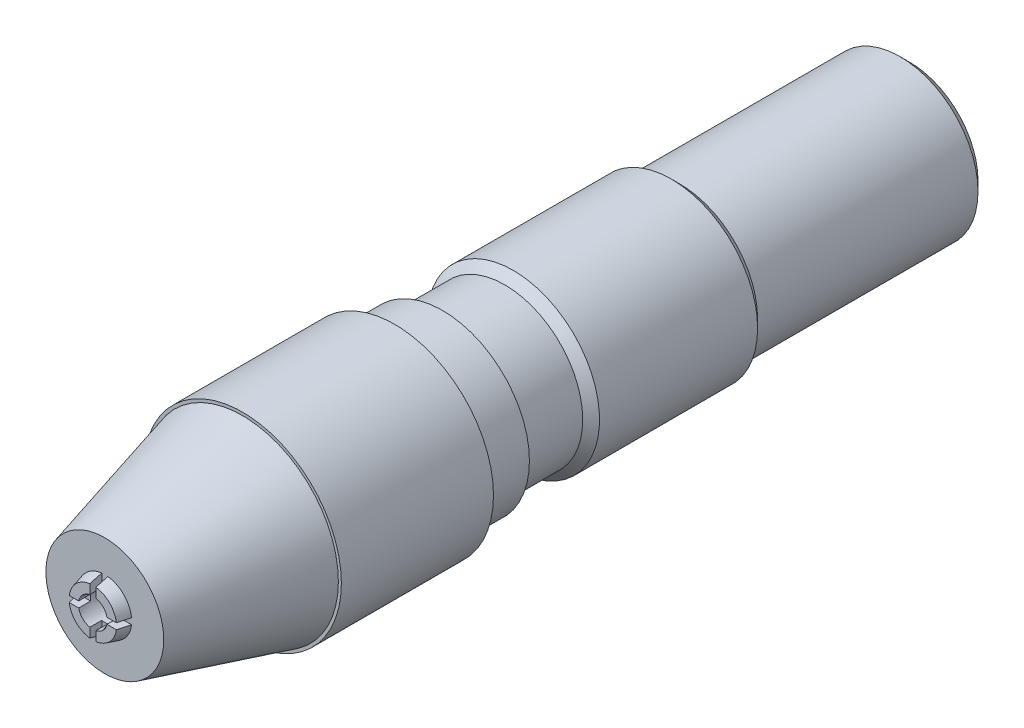
from build123d import *

# Parameters (mm, degrees)
SKETCH1_R               = 3.25
EXTRUDE1_DEPTH          = 10
SKETCH2_R               = 3.6
EXTRUDE2_DEPTH          = 6.5
SKETCH3_R               = 3.25
EXTRUDE3_DEPTH          = 3
SKETCH4_R               = 3.625
EXTRUDE4_DEPTH          = 2
SKETCH5_R               = 4.125
EXTRUDE5_DEPTH          = 6.35
SKETCH6_R               = 4
EXTRUDE6_DEPTH          = 5.75
EXTRUDE6_TAPER          = 15
SKETCH7_R               = 1.125
EXTRUDE7_DEPTH          = 0.5
EXTRUDE7_TAPER          = 15
SKETCH8_W               = 0.254
SKETCH8_H               = 4.684061481
CUT_EXTRUDE_THIN2_DEPTH = 0.5
SKETCH9_W               = 3.205351329
SKETCH9_H               = 0.254
CUT_EXTRUDE_THIN3_DEPTH = 0.5
CHAMFER1_SIZE           = 0.4
SKETCH10_R              = 0.9
CUT_EXTRUDE1_DEPTH      = 34.1
CUT_EXTRUDE1_DRAFT      = -0.5


with BuildPart() as part:
    # Sketch1 → Extrude1 (new body)
    with BuildSketch(Plane.XY):
        Circle(SKETCH1_R)
    extrude(amount=EXTRUDE1_DEPTH)

    # Sketch2 → Extrude2 (add)
    with BuildSketch(Plane.XY.offset(10)):
        with Locations(Location((0, 0, 0), (0, 0, 180))):
            Circle(SKETCH2_R)
    extrude(amount=EXTRUDE2_DEPTH)

    # Sketch3 → Extrude3 (add)
    with BuildSketch(Plane.XY.offset(16.5)):
        Circle(SKETCH3_R)
    extrude(amount=EXTRUDE3_DEPTH)

    # Sketch4 → Extrude4 (add)
    with BuildSketch(Plane.XY.offset(19.5)):
        Circle(SKETCH4_R)
    extrude(amount=EXTRUDE4_DEPTH)

    # Sketch5 → Extrude5 (add)
    with BuildSketch(Plane.XY.offset(21.5)):
        Circle(SKETCH5_R)
    extrude(amount=EXTRUDE5_DEPTH)

    # Sketch6 → Extrude6 (add)
    with BuildSketch(Plane.XY.offset(27.85)):
        Circle(SKETCH6_R)
    extrude(amount=EXTRUDE6_DEPTH, taper=EXTRUDE6_TAPER)

    # Sketch7 → Extrude7 (add)
    with BuildSketch(Plane.XY.offset(33.6)):
        Circle(SKETCH7_R)
    extrude(amount=EXTRUDE7_DEPTH, taper=EXTRUDE7_TAPER)

    # Sketch8 → Cut-Extrude-Thin2 (cut)
    with BuildSketch(Plane.XY.offset(34.1)):
        with Locations((0, -0.157007647)):
            Rectangle(SKETCH8_W, SKETCH8_H)
    extrude(amount=-CUT_EXTRUDE_THIN2_DEPTH, mode=Mode.SUBTRACT)

    # Sketch9 → Cut-Extrude-Thin3 (cut)
    with BuildSketch(Plane.XY.offset(34.1)):
        with Locations((-0.477675664, 0)):
            Rectangle(SKETCH9_W, SKETCH9_H)
    extrude(amount=-CUT_EXTRUDE_THIN3_DEPTH, mode=Mode.SUBTRACT)

    # Chamfer1
    # the kernel refuses this chamfer: 0.4 mm, written as the material it adds along each edge
    with BuildSketch(Plane(origin=(0, 0, 16.5), x_dir=(1, 0, 0), z_dir=(0, -1, 0))) as chamfer1_piece_1_section:
        Polygon((3.25, CHAMFER1_SIZE), (3.25 + CHAMFER1_SIZE, 0), (3.25, 0), align=None)
    chamfer1_piece_1 = revolve(axis=Axis((0, 0, 16.5), (0, 0, 1)), mode=Mode.PRIVATE)
    chamfer1_piece_1 = chamfer1_piece_1 & Plane(origin=(0, 0, 16.722023518), x_dir=(-1, 0, 0), z_dir=(0, 0, -1)) * Cylinder(3.6, 15, mode=Mode.PRIVATE)
    add(chamfer1_piece_1)
    with BuildSketch(Plane(origin=(0, 0, 10), x_dir=(1, 0, 0), z_dir=(0, -1, 0))) as chamfer1_piece_2_section:
        Polygon((3.25 + CHAMFER1_SIZE, 0), (3.25, -CHAMFER1_SIZE), (3.25, 0), align=None)
    chamfer1_piece_2 = revolve(axis=Axis((0, 0, 10), (0, 0, 1)), mode=Mode.PRIVATE)
    chamfer1_piece_2 = chamfer1_piece_2 & Plane(origin=(0, 0, 9.777976482), x_dir=(-1, 0, 0), z_dir=(0, 0, -1)) * Cylinder(3.6, 15, mode=Mode.PRIVATE)
    add(chamfer1_piece_2)
    # the kernel refuses this chamfer: 0.4 mm, written as the material it takes off along each edge
    with BuildSketch(Plane(origin=(0, 0, 0), x_dir=(1, 0, 0), z_dir=(0, -1, 0))) as chamfer1_2_piece_1:
        Polygon((3.25, CHAMFER1_SIZE), (3.25 - CHAMFER1_SIZE, 0), (3.25, 0), align=None)
    revolve(axis=Axis((0, 0, 0), (0, 0, 1)), mode=Mode.SUBTRACT)


with BuildPart() as cut_extrude1_tool:
    # Sketch10 → Cut-Extrude1 (with draft: the straight prism first)
    with BuildSketch(Plane(origin=(0, 0, 0), x_dir=(-1, 0, 0), z_dir=(0, 0, -1))):
        Circle(SKETCH10_R)
    extrude(amount=-CUT_EXTRUDE1_DEPTH)
    # Cut-Extrude1: the draft: its side faces are tilted about the plane it starts from
    cut_extrude1_sides = [cut_extrude1_tool.faces().sort_by_distance(p)[0] for p in [
        (0.9, 0, 17.05),
    ]]
    draft(cut_extrude1_sides, Plane(origin=(0, 0, 0), x_dir=(-1, 0, 0), z_dir=(0, 0, -1)), CUT_EXTRUDE1_DRAFT)


with BuildPart() as part_1:
    add(part.part)

    # Cut-Extrude1: cut by cut_extrude1_tool
    add(cut_extrude1_tool.part, mode=Mode.SUBTRACT)


solid = part_1.part
